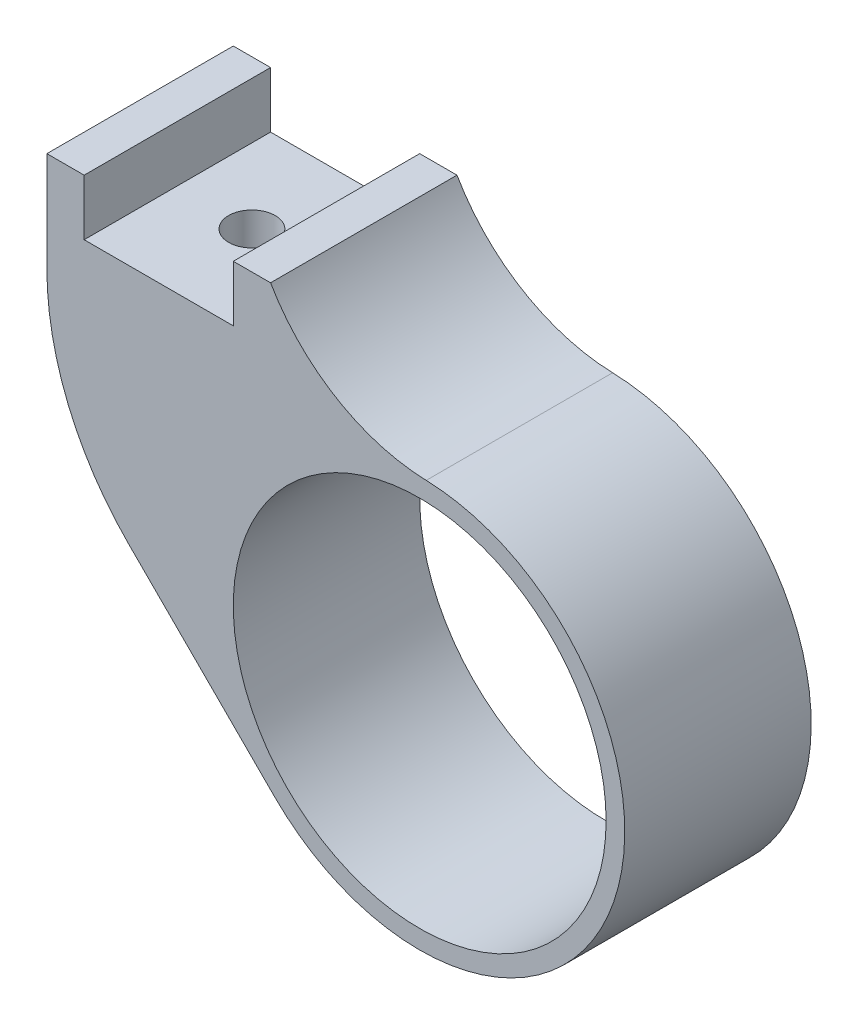
from build123d import *

# Parameters (mm, degrees)
SKETCH1_R           = 10
BOSS_EXTRUDE1_DEPTH = 10
FILLET1_R           = 10
M3_TAPPED_HOLE1_D   = 2.5
FILLET2_R           = 15


with BuildPart() as part:
    # Sketch1 → Boss-Extrude1 (new body)
    with BuildSketch(Plane.XY):
        with BuildLine():
            Line((-18, 16), (-20, 16))
            Line((-20, 16), (-20, 4.443650814))
            Line((-20, 4.443650814), (-7.778174593, -7.778174593))
            ThreePointArc((-7.778174593, -7.778174593), (10.998848284, 0.159174228), (-8, 7.549834435))
            Line((-8, 7.549834435), (-8, 16))
            Line((-8, 16), (-10, 16))
            Line((-10, 16), (-10, 13))
            Line((-10, 13), (-18, 13))
            Line((-18, 13), (-18, 16))
        make_face()
        Circle(SKETCH1_R, mode=Mode.SUBTRACT)
    extrude(amount=BOSS_EXTRUDE1_DEPTH)

    # Fillet1
    # the kernel refuses this fillet: 10 mm, written as the material it adds along each edge
    with BuildSketch(Plane(origin=(-8, 7.549834435, 0), x_dir=(0, 1, 0), z_dir=(0, 0, 1))) as fillet1_piece_1:
        with BuildLine():
            CenterArc((13.43959092, -8.66635071), FILLET1_R, 119.930063337, 58.25157985)
            Line((3.444626465, -8.349040848), (3.244727176, -8.342694651))
            ThreePointArc((3.244727176, -8.342694651), (2.433829653, -3.880964752), (-0.137269717, -0.145454545))
            Line((-0.137269717, -0.145454545), (0, 0.2))
            ThreePointArc((0, 0.2), (4.225082782, 0.2), (8.350377058, 0.173327014))
            Line((8.350377058, 0.173327014), (8.450165565, 0))
        make_face()
    extrude(amount=10)

    # M3 Tapped Hole1 (through all)
    with Locations(Plane(origin=(0, 13, 0), x_dir=(1, 0, 0), z_dir=(0, 1, 0))):
        with Locations((-14, -5)):
            Hole(M3_TAPPED_HOLE1_D / 2)

    # Fillet2
    fillet2_edges = [part.edges().sort_by_distance(p)[0] for p in [
        (-20, 4.443650814, 5),
    ]]
    fillet(fillet2_edges, radius=FILLET2_R)


solid = part.part
